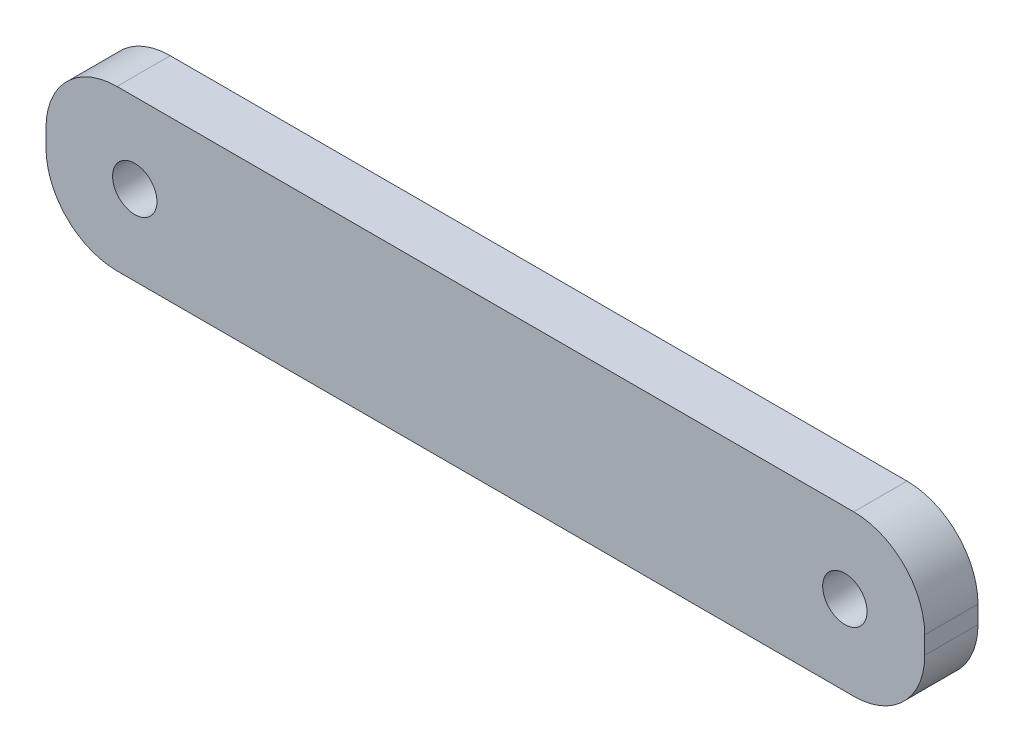
from build123d import *

# Parameters (mm, degrees)
CROQUIS1_W                = 49.5
CROQUIS1_H                = 9
CROQUIS1_R                = 1.25
BRIDA_BASE1_DEPTH         = 3
TALADRO_ROSCADO_M31_D     = 2.5
TALADRO_ROSCADO_M31_DEPTH = 3
REDONDEO1_R               = 4


# Sheet-metal steps are written as plain solids
with BuildPart() as part:
    # Croquis1 → Brida base1 (new body)
    with BuildSketch(Plane.XY):
        with Locations((24.75, 4.5)):
            Rectangle(CROQUIS1_W, CROQUIS1_H)
        with Locations((5, 4.5)):
            Circle(CROQUIS1_R, mode=Mode.SUBTRACT)
        with Locations((45, 4.5)):
            Circle(CROQUIS1_R, mode=Mode.SUBTRACT)
    extrude(amount=-BRIDA_BASE1_DEPTH)

    # Taladro roscado M31
    with Locations(Plane(origin=(5, 4.5, 0), x_dir=(1, 0, 0), z_dir=(0, 0, 1))):
        with Locations((0, 0), (40, 0)):
            Hole(TALADRO_ROSCADO_M31_D / 2, depth=TALADRO_ROSCADO_M31_DEPTH)

    # Redondeo1
    redondeo1_edges = [part.edges().sort_by_distance(p)[0] for p in [
        (0, 9, -1.5),
        (49.5, 9, -1.5),
        (49.5, 0, -1.5),
        (0, 0, -1.5),
    ]]
    fillet(redondeo1_edges, radius=REDONDEO1_R)


solid = part.part
